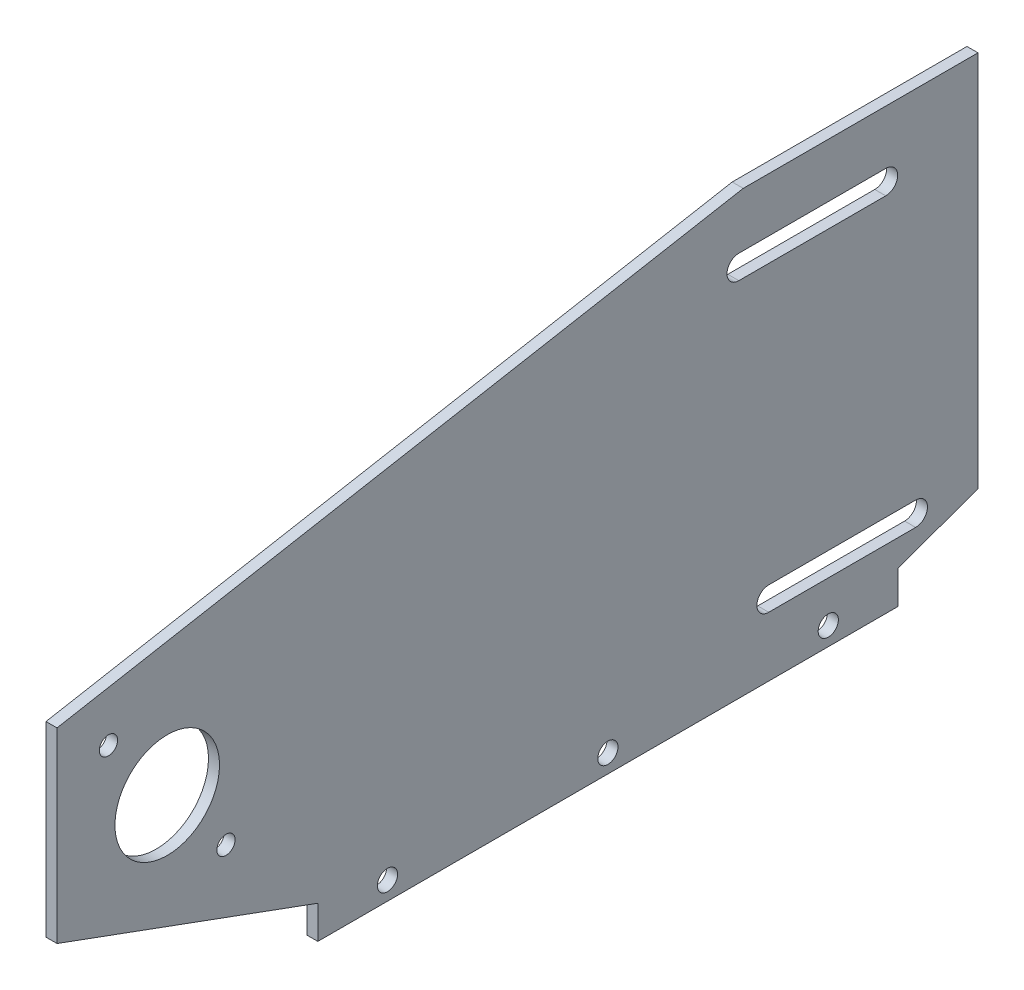
from build123d import *

# Parameters (mm, degrees)
SKETCH1_W           = 300
SKETCH1_H           = 150
SKETCH1_R           = 14.235
BOSS_EXTRUDE1_DEPTH = 3
CUT_EXTRUDE1_REACH  = 337.424
SKETCH2_R           = 3.225
SKETCH3_R           = 2.4892
CUT_EXTRUDE2_DEPTH  = 336.423612765
CUT_EXTRUDE3_DEPTH  = 336.423612765
CUT_EXTRUDE4_DEPTH  = 10
CUT_EXTRUDE5_DEPTH  = 10
SKETCH7_R           = 2.75
CUT_EXTRUDE6_DEPTH  = 278.817527592


with BuildPart() as part:
    # Sketch1 → Boss-Extrude1 (new body)
    with BuildSketch(Plane(origin=(0, 0, 0), x_dir=(0, 0, -1), z_dir=(1, 0, 0))):
        with Locations((150, 75)):
            Rectangle(SKETCH1_W, SKETCH1_H)
        with Locations((30, 55)):
            Circle(SKETCH1_R, mode=Mode.SUBTRACT)
    extrude(amount=BOSS_EXTRUDE1_DEPTH)

    # Sketch2 → Cut-Extrude1 (cut, up to next)
    with BuildSketch(Plane.ZY, mode=Mode.PRIVATE) as cut_extrude1_sk1:
        with Locations((-290, 140)):
            Circle(SKETCH2_R)
    cut_extrude1_tool1 = extrude(cut_extrude1_sk1.sketch, amount=-CUT_EXTRUDE1_REACH, mode=Mode.PRIVATE) & part.part
    # Sketch2 → Cut-Extrude1 (cut, up to next)
    with BuildSketch(Plane.ZY, mode=Mode.PRIVATE) as cut_extrude1_sk2:
        with Locations((-10, 110)):
            Circle(SKETCH2_R)
    cut_extrude1_tool2 = extrude(cut_extrude1_sk2.sketch, amount=-CUT_EXTRUDE1_REACH, mode=Mode.PRIVATE) & part.part
    # Sketch2 → Cut-Extrude1 (cut, up to next)
    with BuildSketch(Plane.ZY, mode=Mode.PRIVATE) as cut_extrude1_sk3:
        with Locations((-290, 30)):
            Circle(SKETCH2_R)
    cut_extrude1_tool3 = extrude(cut_extrude1_sk3.sketch, amount=-CUT_EXTRUDE1_REACH, mode=Mode.PRIVATE) & part.part
    # Sketch2 → Cut-Extrude1 (cut, up to next)
    with BuildSketch(Plane.ZY, mode=Mode.PRIVATE) as cut_extrude1_sk4:
        with BuildLine():
            Line((-185.611446384, 98.478413591), (-225.611446384, 98.478413591))
            ThreePointArc((-225.611446384, 98.478413591), (-228.841446384, 101.708413591), (-225.611446384, 104.938413591))
            Line((-225.611446384, 104.938413591), (-185.611446384, 104.938413591))
            ThreePointArc((-185.611446384, 104.938413591), (-182.381446384, 101.708413591), (-185.611446384, 98.478413591))
        make_face()
    cut_extrude1_tool4 = extrude(cut_extrude1_sk4.sketch, amount=-CUT_EXTRUDE1_REACH, mode=Mode.PRIVATE) & part.part
    # Sketch2 → Cut-Extrude1 (cut, up to next)
    with BuildSketch(Plane.ZY, mode=Mode.PRIVATE) as cut_extrude1_sk5:
        with BuildLine():
            Line((-233.743605698, 22.681694356), (-193.743605698, 22.681694356))
            ThreePointArc((-193.743605698, 22.681694356), (-190.518605698, 19.456694356), (-193.743605698, 16.231694356))
            Line((-193.743605698, 16.231694356), (-233.743605698, 16.231694356))
            ThreePointArc((-233.743605698, 16.231694356), (-236.968605698, 19.456694356), (-233.743605698, 22.681694356))
        make_face()
    cut_extrude1_tool5 = extrude(cut_extrude1_sk5.sketch, amount=-CUT_EXTRUDE1_REACH, mode=Mode.PRIVATE) & part.part
    add(cut_extrude1_tool1.solids().sort_by_distance((0, 140, -290))[0], mode=Mode.SUBTRACT)
    add(cut_extrude1_tool2.solids().sort_by_distance((0, 110, -10))[0], mode=Mode.SUBTRACT)
    add(cut_extrude1_tool3.solids().sort_by_distance((0, 30, -290))[0], mode=Mode.SUBTRACT)
    add(cut_extrude1_tool4.solids().sort_by_distance((0, 101.708414, -205.611446))[0], mode=Mode.SUBTRACT)
    add(cut_extrude1_tool5.solids().sort_by_distance((0, 19.456694, -213.743606))[0], mode=Mode.SUBTRACT)

    # Sketch3 → Cut-Extrude2 (cut, through all)
    with BuildSketch(Plane(origin=(3, 0, 0), x_dir=(0, 0, -1), z_dir=(1, 0, 0))):
        with Locations((14.005743185, 74.73179538)):
            Circle(SKETCH3_R)
        with Locations((45.994256815, 35.26820462)):
            Circle(SKETCH3_R)
    extrude(amount=-CUT_EXTRUDE2_DEPTH, mode=Mode.SUBTRACT)

    # Sketch4 → Cut-Extrude3 (cut, through all)
    with BuildSketch(Plane(origin=(3, 0, 0), x_dir=(0, 0, -1), z_dir=(1, 0, 0))):
        Polygon((71, 9), (0, 35), (0, 0), (71, 0), align=None)
    extrude(amount=-CUT_EXTRUDE3_DEPTH, mode=Mode.SUBTRACT)

    # Sketch5 → Cut-Extrude4 (cut)
    with BuildSketch(Plane(origin=(3, 0, 0), x_dir=(0, 0, -1), z_dir=(1, 0, 0))):
        Polygon((228.92403237, 9), (250.717958721, 16.875947155), (250.717958721, 150), (312.660420977, 150), (312.660420977, -2.829604392), (228.92403237, 0), align=None)
    extrude(amount=-CUT_EXTRUDE4_DEPTH, mode=Mode.SUBTRACT)

    # Sketch6 → Cut-Extrude5 (cut)
    with BuildSketch(Plane(origin=(3, 0, 0), x_dir=(0, 0, -1), z_dir=(1, 0, 0))):
        Polygon((0, 85.848631797), (186.802640374, 119.641480316), (250.717958721, 119.641480316), (250.717958721, 150), (0, 150), align=None)
    extrude(amount=-CUT_EXTRUDE5_DEPTH, mode=Mode.SUBTRACT)

    # Sketch7 → Cut-Extrude6 (cut, through all)
    with BuildSketch(Plane.ZY):
        with Locations((-209.962016185, 5)):
            Circle(SKETCH7_R)
        with Locations((-149.962016185, 5)):
            Circle(SKETCH7_R)
        with Locations((-89.962016185, 5)):
            Circle(SKETCH7_R)
    extrude(amount=-CUT_EXTRUDE6_DEPTH, mode=Mode.SUBTRACT)


solid = part.part
